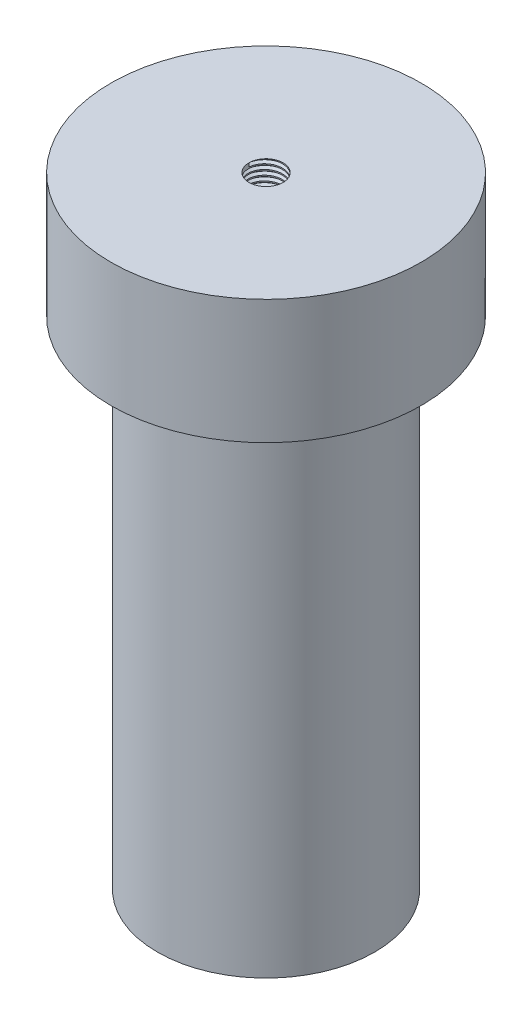
from build123d import *
from build123d.topology import SkipClean

# Parameters (mm, degrees)
SKETCH1_R           = 17.5
BOSS_EXTRUDE1_DEPTH = 100
SKETCH2_R           = 25
BOSS_EXTRUDE2_DEPTH = 20
SKETCH3_R           = 2.75
CUT_EXTRUDE1_DEPTH  = 10
THREAD1_PITCH       = 0.8


with BuildPart() as part:
    # Sketch1 → Boss-Extrude1 (new body)
    with BuildSketch(Plane(origin=(0, 0, 0), x_dir=(1, 0, 0), z_dir=(0, 1, 0))):
        with Locations(Location((0, 0, 0), (0, 0, 270))):
            Circle(SKETCH1_R)
    extrude(amount=-BOSS_EXTRUDE1_DEPTH)

    # Sketch2 → Boss-Extrude2 (add)
    with BuildSketch(Plane(origin=(0, 0, 0), x_dir=(1, 0, 0), z_dir=(0, 1, 0))):
        with Locations(Location((0, 0, 0), (0, 0, 270))):
            Circle(SKETCH2_R)
    extrude(amount=-BOSS_EXTRUDE2_DEPTH)

    # Sketch3 → Cut-Extrude1 (cut)
    with BuildSketch(Plane(origin=(0, 0, 0), x_dir=(1, 0, 0), z_dir=(0, 1, 0))):
        with Locations(Location((0, 0, 0), (0, 0, 270))):
            Circle(SKETCH3_R)
    extrude(amount=-CUT_EXTRUDE1_DEPTH, mode=Mode.SUBTRACT)

    # Thread1: the profile of Thread Profile1 profile screwed along a right-hand helix of 12.5 turns, 8 arcs to a turn; built about Z, then put on its axis
    with SkipClean():  # the faces are left unmerged after this step: merging them gives an invalid solid
        thread1_z = Axis((0, 0, 0), (0, 0, 1))
        thread1_corners = [(2.7497, 0, -0.000173205), (3.1830127, 0, 0.249999999), (3.1830127, 0, 0.349999999), (2.7497, 0, 0.600173203)]
        with BuildLine(mode=Mode.PRIVATE) as thread1_profile:
            Line(thread1_corners[0], thread1_corners[1])
            Line(thread1_corners[1], thread1_corners[2])
            Line(thread1_corners[2], thread1_corners[3])
            Line(thread1_corners[3], thread1_corners[0])
        thread1_cap = Face(thread1_profile.wire())
        thread1_turn_angles = [0, 22.5, 45, 67.5, 90, 112.5, 135, 157.5, 180, 202.5, 225, 247.5, 270, 292.5, 315, 337.5, 360]
        thread1_turn_weights = [1, 0.9238795325112867, 1, 0.9238795325112867, 1, 0.9238795325112867, 1, 0.9238795325112867, 1, 0.9238795325112867, 1, 0.9238795325112867, 1, 0.9238795325112867, 1, 0.9238795325112867, 1]
        thread1_turn_rails = [Edge.make_bspline([Vector(p[0], p[1], 0).rotate(thread1_z, thread1_turn_angles[k]) / thread1_turn_weights[k] + Vector(0, 0, p[2] + THREAD1_PITCH * thread1_turn_angles[k] / 360) for k in range(17)], [0, 0, 0, 1, 1, 2, 2, 3, 3, 4, 4, 5, 5, 6, 6, 7, 7, 8, 8, 8], 2, thread1_turn_weights) for p in thread1_corners]
        thread1_turn_sides = [Face.make_surface_from_curves(thread1_turn_rails[p[0]], thread1_turn_rails[p[1]]) for p in [(0, 1), (1, 2), (2, 3), (3, 0)]]
        thread1_last_angles = [4320, 4342.5, 4365, 4387.5, 4410, 4432.5, 4455, 4477.5, 4500]
        thread1_last_weights = [1, 0.9238795325112867, 1, 0.9238795325112867, 1, 0.9238795325112867, 1, 0.9238795325112867, 1]
        thread1_last_rails = [Edge.make_bspline([Vector(p[0], p[1], 0).rotate(thread1_z, thread1_last_angles[k]) / thread1_last_weights[k] + Vector(0, 0, p[2] + THREAD1_PITCH * thread1_last_angles[k] / 360) for k in range(9)], [0, 0, 0, 1, 1, 2, 2, 3, 3, 4, 4, 4], 2, thread1_last_weights) for p in thread1_corners]
        thread1_last_sides = [Face.make_surface_from_curves(thread1_last_rails[p[0]], thread1_last_rails[p[1]]) for p in [(0, 1), (1, 2), (2, 3), (3, 0)]]
        thread1 = Plane(origin=(0, 0, 0), x_dir=(-1, 0, 0), z_dir=(0, -1, 0)) * Solid(Shell([*[p.moved(Location((0, 0, THREAD1_PITCH * i))) for i in range(12) for p in thread1_turn_sides], *thread1_last_sides, thread1_cap, thread1_cap.rotate(thread1_z, 4500).moved(Location((0, 0, THREAD1_PITCH * 4500 / 360)))]))
        add(thread1, mode=Mode.SUBTRACT)


solid = part.part
